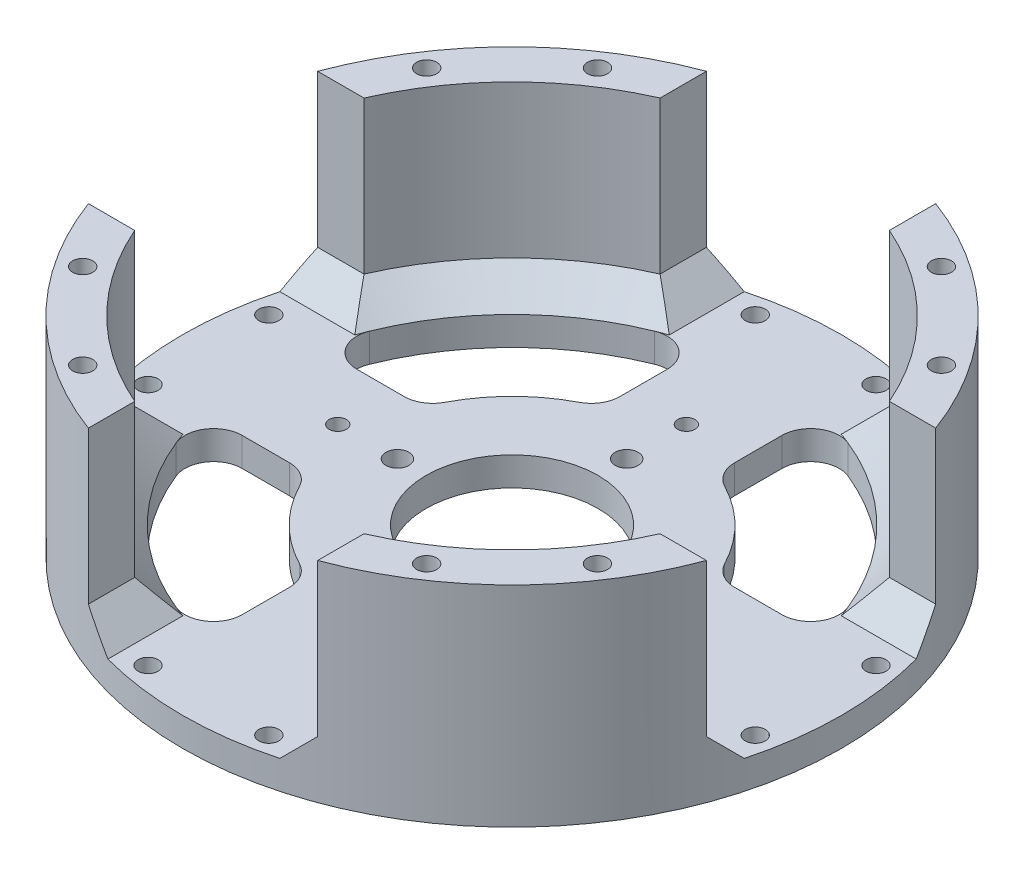
from build123d import *

# Parameters (mm, degrees)
SKETCH1_R           = 57.5
BOSS_EXTRUDE1_DEPTH = 36.6
SKETCH2_R           = 50
CUT_EXTRUDE1_DEPTH  = 31.6
SKETCH3_R           = 2
SKETCH3_R_2         = 15
CUT_EXTRUDE2_DEPTH  = 31.8
SKETCH4_R           = 1.5
SKETCH4_R_2         = 1.75
CUT_EXTRUDE3_DEPTH  = 50
SKETCH9_W           = 40
SKETCH9_H           = 31.6
CUT_EXTRUDE4_DEPTH  = 72
CIRPATTERN1_COUNT   = 4
FILLET2_R           = 5
CHAMFER1_SIZE       = 5


with BuildPart() as part:
    # Sketch1 → Boss-Extrude1 (new body)
    with BuildSketch(Plane(origin=(0, 0, 0), x_dir=(1, 0, 0), z_dir=(0, 1, 0))):
        with Locations(Location((0, 0, 0), (0, 0, 270))):
            Circle(SKETCH1_R)
    extrude(amount=BOSS_EXTRUDE1_DEPTH)

    # Sketch2 → Cut-Extrude1 (cut)
    with BuildSketch(Plane(origin=(0, 36.6, 0), x_dir=(1, 0, 0), z_dir=(0, 1, 0))):
        with Locations(Location((0, 0, 0), (0, 0, 270))):
            Circle(SKETCH2_R)
    extrude(amount=-CUT_EXTRUDE1_DEPTH, mode=Mode.SUBTRACT)

    # Sketch3 → Cut-Extrude2 (cut)
    with BuildSketch(Plane.XZ):
        with BuildLine():
            Line((-10, 25.617376915), (-10, 43.874821937))
            ThreePointArc((-10, 43.874821937), (-31.819805153, 31.819805153), (-43.874821937, 10))
            Line((-43.874821937, 10), (-25.617376915, 10))
            ThreePointArc((-25.617376915, 10), (-19.445436483, 19.445436483), (-10, 25.617376915))
        make_face()
        with BuildLine():
            Line((25.617376915, 10), (43.874821937, 10))
            ThreePointArc((43.874821937, 10), (31.819805153, 31.819805153), (10, 43.874821937))
            Line((10, 43.874821937), (10, 25.617376915))
            ThreePointArc((10, 25.617376915), (19.445436483, 19.445436483), (25.617376915, 10))
        make_face()
        with BuildLine():
            ThreePointArc((10, -43.874821937), (31.819805153, -31.819805153), (43.874821937, -10))
            Line((43.874821937, -10), (25.617376915, -10))
            ThreePointArc((25.617376915, -10), (19.445436483, -19.445436483), (10, -25.617376915))
            Line((10, -25.617376915), (10, -43.874821937))
        make_face()
        with BuildLine():
            ThreePointArc((-43.874821937, -10), (-31.819805153, -31.819805153), (-10, -43.874821937))
            Line((-10, -43.874821937), (-10, -25.617376915))
            ThreePointArc((-10, -25.617376915), (-19.445436483, -19.445436483), (-25.617376915, -10))
            Line((-25.617376915, -10), (-43.874821937, -10))
        make_face()
        with Locations(Location((-20, 0, 0), (0, 0, 270))):
            Circle(SKETCH3_R)
        with Locations(Location((0, 0, 0), (0, 0, 270))):
            Circle(SKETCH3_R_2)
        with Locations(Location((0, 20, 0), (0, 0, 270))):
            Circle(SKETCH3_R)
        with Locations(Location((20, 0, 0), (0, 0, 270))):
            Circle(SKETCH3_R)
        with Locations(Location((0, -20, 0), (0, 0, 270))):
            Circle(SKETCH3_R)
    extrude(amount=-CUT_EXTRUDE2_DEPTH, mode=Mode.SUBTRACT)

    # Sketch4 → Cut-Extrude3 (cut)
    with BuildSketch(Plane.XZ):
        with Locations(Location((0, 30.405591591, 0), (0, 0, 270))):
            Circle(SKETCH4_R)
        with Locations(Location((30.405591591, 0, 0), (0, 0, 270))):
            Circle(SKETCH4_R)
        with Locations(Location((0, -30.405591591, 0), (0, 0, 270))):
            Circle(SKETCH4_R)
        with Locations(Location((-30.405591591, 0, 0), (0, 0, 270))):
            Circle(SKETCH4_R)
        with Locations(Location((-10.534877389, 52.962405142, 0), (0, 0, 270))):
            Circle(SKETCH4_R_2)
        with Locations(Location((10.534877389, 52.962405142, 0), (0, 0, 270))):
            Circle(SKETCH4_R_2)
        with Locations(Location((30.000792583, 44.899359064, 0), (0, 0, 270))):
            Circle(SKETCH4_R_2)
        with Locations(Location((44.899359064, 30.000792583, 0), (0, 0, 270))):
            Circle(SKETCH4_R_2)
        with Locations(Location((52.962405142, 10.534877389, 0), (0, 0, 270))):
            Circle(SKETCH4_R_2)
        with Locations(Location((52.962405142, -10.534877389, 0), (0, 0, 270))):
            Circle(SKETCH4_R_2)
        with Locations(Location((44.899359064, -30.000792583, 0), (0, 0, 270))):
            Circle(SKETCH4_R_2)
        with Locations(Location((30.000792583, -44.899359064, 0), (0, 0, 270))):
            Circle(SKETCH4_R_2)
        with Locations(Location((10.534877389, -52.962405142, 0), (0, 0, 270))):
            Circle(SKETCH4_R_2)
        with Locations(Location((-10.534877389, -52.962405142, 0), (0, 0, 270))):
            Circle(SKETCH4_R_2)
        with Locations(Location((-30.000792583, -44.899359064, 0), (0, 0, 270))):
            Circle(SKETCH4_R_2)
        with Locations(Location((-44.899359064, -30.000792583, 0), (0, 0, 270))):
            Circle(SKETCH4_R_2)
        with Locations(Location((-52.962405142, -10.534877389, 0), (0, 0, 270))):
            Circle(SKETCH4_R_2)
        with Locations(Location((-52.962405142, 10.534877389, 0), (0, 0, 270))):
            Circle(SKETCH4_R_2)
        with Locations(Location((-44.899359064, 30.000792583, 0), (0, 0, 270))):
            Circle(SKETCH4_R_2)
        with Locations(Location((-30.000792583, 44.899359064, 0), (0, 0, 270))):
            Circle(SKETCH4_R_2)
    extrude(amount=-CUT_EXTRUDE3_DEPTH, mode=Mode.SUBTRACT)

    # Sketch9 → Cut-Extrude4 (cut)
    with BuildSketch(Plane.XY):
        with Locations((0, 20.8)):
            Rectangle(SKETCH9_W, SKETCH9_H)
    cut_extrude4 = extrude(amount=-CUT_EXTRUDE4_DEPTH, mode=Mode.SUBTRACT)

    # CirPattern1: Cut-Extrude4 ×4 about axis
    cirpattern1_axis = Axis((0, 0, 0), (0, 1, 0))
    for i in range(1, CIRPATTERN1_COUNT):
        add(cut_extrude4.rotate(cirpattern1_axis, i * 360 / CIRPATTERN1_COUNT), mode=Mode.SUBTRACT)

    # Fillet2
    fillet2_edges = [part.edges().sort_by_distance(p)[0] for p in [
        (43.874821937, 2.5, 10),
        (25.617376915, 2.5, 10),
        (10, 2.5, 25.617376915),
        (10, 2.5, 43.874821937),
        (10, 2.5, -43.874821937),
        (10, 2.5, -25.617376915),
        (25.617376915, 2.5, -10),
        (43.874821937, 2.5, -10),
        (-43.874821937, 2.5, -10),
        (-25.617376915, 2.5, -10),
        (-10, 2.5, -25.617376915),
        (-10, 2.5, -43.874821937),
        (-10, 2.5, 43.874821937),
        (-10, 2.5, 25.617376915),
        (-25.617376915, 2.5, 10),
        (-43.874821937, 2.5, 10),
    ]]
    fillet(fillet2_edges, radius=FILLET2_R)

    # Chamfer1
    chamfer1_edges = [part.edges().sort_by_distance(p)[0] for p in [
        (-35.355339059, 5, -35.355339059),
        (-20, 5, -49.867701791),
        (20, 5, -49.867701791),
        (-35.355339059, 5, 35.355339059),
        (35.355339059, 5, 35.355339059),
        (35.355339059, 5, -35.355339059),
        (-49.867701791, 5, 20),
        (20, 5, 49.867701791),
        (49.867701791, 5, -20),
        (49.867701791, 5, 20),
        (-20, 5, 49.867701791),
        (-49.867701791, 5, -20),
    ]]
    chamfer(chamfer1_edges, length=CHAMFER1_SIZE - 0.0001)  # a hair under: the kernel refuses the full size


solid = part.part
